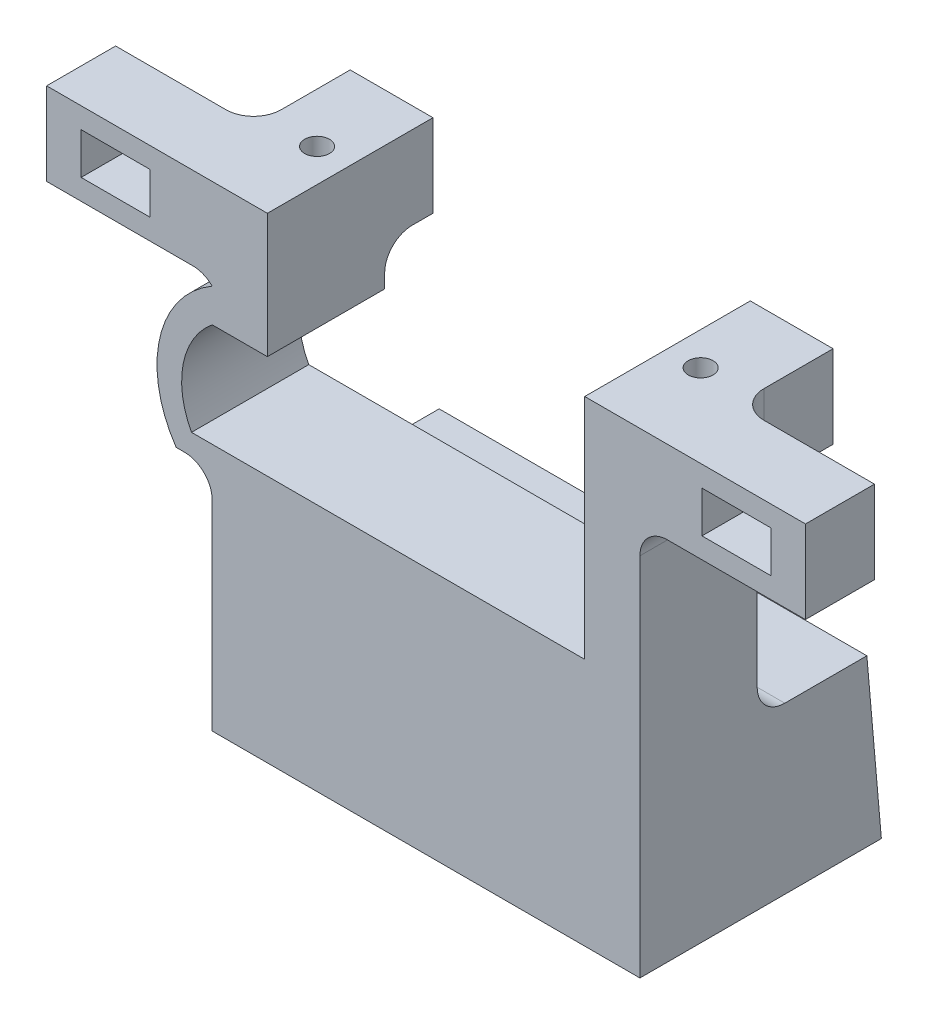
from build123d import *

# Parameters (mm, degrees)
SKETCH1_W                   = 6
SKETCH1_H                   = 12
SKETCH1_R                   = 0.9
SERVO_MOUNTING_BASE_DEPTH   = 6
SERVO_MOUNTING_BASE_2_DEPTH = 6
SERVO_ENCLOSING_FRAME_DEPTH = 2.5
WIRE_SLOT_DEPTH             = 34.977934016
WIRE_SLOT_DEPTH_BACK        = 34.977934016
SKETCH6_W                   = 4
SKETCH6_H                   = 9
WIRE_COMPENSATION_DEPTH     = 2.5
CLAMP_EXTENSION_DEPTH       = 31
SKETCH12_W                  = 1.9
SKETCH12_H                  = 12.5
SKETCH13_R                  = 1.375
CLAMP_SCREW_HOLES_DEPTH     = 6
SKETCH15_W                  = 10
SKETCH15_H                  = 5
ZIPTIE_FLAPS_DEPTH          = 6
ZIPTIE_HOLES_REACH          = 45.298
SKETCH17_W                  = 5
SKETCH17_H                  = 3
FRONT_EXTENSION_DEPTH       = 3.5
F_2MM_FILLETS_R             = 2
MORE_2MM_FILLETS_R          = 2


with BuildPart() as part:
    # Sketch1 → Servo Mounting Base (new body)
    with BuildSketch(Plane(origin=(0, 0, 0), x_dir=(1, 0, 0), z_dir=(0, 1, 0))):
        with Locations((-14.5, 0)):
            Rectangle(SKETCH1_W, SKETCH1_H)
        with Locations(Location((-13.9, 0, 0), (0, 0, 270))):
            Circle(SKETCH1_R, mode=Mode.SUBTRACT)
    extrude(amount=SERVO_MOUNTING_BASE_DEPTH)



with BuildPart() as body_2:
    # Sketch1 → Servo Mounting Base 2 (new body)
    with BuildSketch(Plane(origin=(0, 0, 0), x_dir=(1, 0, 0), z_dir=(0, 1, 0))):
        with Locations((14.5, 0)):
            Rectangle(SKETCH1_W, SKETCH1_H)
        with Locations(Location((13.9, 0, 0), (0, 0, 270))):
            Circle(SKETCH1_R, mode=Mode.SUBTRACT)
    extrude(amount=SERVO_MOUNTING_BASE_2_DEPTH)


with BuildPart() as part_1:
    add(part.part)

    add(body_2.part)  # Servo Enclosing Frame merges body 2
    # Sketch2 → Servo Enclosing Frame (add, symmetric)
    with BuildSketch(Plane.XY):
        Polygon((-15.5, 0), (-15.5, -28.5), (15.5, -28.5), (15.5, 0), (11.5, 0), (11.5, -10.5), (-11.5, -10.5), (-11.5, 0), align=None)
    extrude(amount=SERVO_ENCLOSING_FRAME_DEPTH, both=True)

    # Sketch6 → Wire Slot (cut, two sides: drawn at the far end of the back side and taken through both)
    with BuildSketch(Plane.XY.offset(-WIRE_SLOT_DEPTH_BACK)):
        with Locations((-13.5, -7.5)):
            Rectangle(SKETCH6_W, SKETCH6_H)
    extrude(amount=WIRE_SLOT_DEPTH + WIRE_SLOT_DEPTH_BACK, mode=Mode.SUBTRACT)


with BuildPart() as wire_slot_piece_1:
    # of the separate pieces the step leaves, piece 1, a body of its own (wire_slot_pieces)
    add(part_1.part.solids().sort_by_distance((11.5, -10.5, -2.5))[0])



with BuildPart() as wire_slot_piece_2:
    # of the separate pieces the step leaves, piece 2, a body of its own (wire_slot_pieces)
    add(part_1.part.solids().sort_by_distance((-17.5, 0, -6))[0])


with BuildPart() as wire_slot_piece_1_1:
    add(wire_slot_piece_1.part)

    add(wire_slot_piece_2.part)  # Wire Compensation merges Wire Slot piece 2
    # Sketch7 → Wire Compensation (add, symmetric)
    with BuildSketch(Plane.XY):
        with BuildLine():
            Line((-11.5, -12), (-18.114378278, -12))
            ThreePointArc((-18.114378278, -12), (-19.298539211, -5.715963516), (-15.5, -0.57179677))
            Line((-15.5, -0.57179677), (-15.5, -3))
            ThreePointArc((-15.5, -3), (-17.599955118, -6.480008976), (-17, -10.5))
            Line((-17, -10.5), (-11.5, -10.5))
            Line((-11.5, -10.5), (-11.5, -12))
        make_face()
    extrude(amount=WIRE_COMPENSATION_DEPTH, both=True)

    # Sketch9 → Clamp Extension (add)
    with BuildSketch(Plane.ZY.offset(15.5)):
        Polygon((-2.5, -28.5), (-11.5, -28.5), (-10.450136038, -16.5), (-2.5, -16.5), align=None)
    extrude(amount=-CLAMP_EXTENSION_DEPTH)

    # Sketch12 → Wire Groove (revolve, cut)
    with BuildSketch(Plane(origin=(0, 0.781987502, -8.938158048), x_dir=(-1, 0, 0), z_dir=(0, 0.08715574274766176, -0.9961946980917453))):
        with Locations((-0.95, -23.143839937)):
            Rectangle(SKETCH12_W, SKETCH12_H)
    revolve(axis=Axis((0, -16.047566274, -10.410553216), (0, -0.9961946980917452, -0.0871557427476618)), mode=Mode.SUBTRACT)

    # Sketch13 → Clamp Screw Holes (cut)
    with BuildSketch(Plane(origin=(0, 0.781987502, -8.938158048), x_dir=(-1, 0, 0), z_dir=(0, 0.08715574274766176, -0.9961946980917453))):
        with Locations(Location((-8.5, -23.370920912, 0), (0, 0, 90))):
            Circle(SKETCH13_R)
        with Locations(Location((8.5, -23.370920912, 0), (0, 0, 270))):
            Circle(SKETCH13_R)
    extrude(amount=-CLAMP_SCREW_HOLES_DEPTH, mode=Mode.SUBTRACT)

    # Sketch15 → Ziptie Flaps (add)
    with BuildSketch(Plane(origin=(0, 6, 0), x_dir=(1, 0, 0), z_dir=(0, 1, 0))):
        with Locations((-22.5, -3.5)):
            Rectangle(SKETCH15_W, SKETCH15_H)
        with Locations((22.5, -3.5)):
            Rectangle(SKETCH15_W, SKETCH15_H)
    extrude(amount=-ZIPTIE_FLAPS_DEPTH)

    # Sketch17 → Ziptie Holes (cut, up to next)
    with BuildSketch(Plane.XY.offset(6), mode=Mode.PRIVATE) as ziptie_holes_sk1:
        with Locations((-22.5, 3)):
            Rectangle(SKETCH17_W, SKETCH17_H)
    ziptie_holes_tool1 = extrude(ziptie_holes_sk1.sketch, amount=-ZIPTIE_HOLES_REACH, mode=Mode.PRIVATE) & wire_slot_piece_1_1.part
    # Sketch17 → Ziptie Holes (cut, up to next)
    with BuildSketch(Plane.XY.offset(6), mode=Mode.PRIVATE) as ziptie_holes_sk2:
        with Locations((22.5, 3)):
            Rectangle(SKETCH17_W, SKETCH17_H)
    ziptie_holes_tool2 = extrude(ziptie_holes_sk2.sketch, amount=-ZIPTIE_HOLES_REACH, mode=Mode.PRIVATE) & wire_slot_piece_1_1.part
    add(ziptie_holes_tool1.solids().sort_by_distance((-22.5, 3, 6))[0], mode=Mode.SUBTRACT)
    add(ziptie_holes_tool2.solids().sort_by_distance((22.5, 3, 6))[0], mode=Mode.SUBTRACT)

    # Sketch16 → Front Extension (add)
    with BuildSketch(Plane.XY.offset(2.5)):
        with BuildLine():
            Line((-15.5, 0), (-15.5, -0.57179677))
            ThreePointArc((-15.5, -0.57179677), (-19.298539211, -5.715963516), (-18.114378278, -12))
            Line((-18.114378278, -12), (-15.5, -12))
            Line((-15.5, -12), (-15.5, -28.5))
            Line((-15.5, -28.5), (15.5, -28.5))
            Line((15.5, -28.5), (15.5, 0))
            Line((15.5, 0), (11.5, 0))
            Line((11.5, 0), (11.5, -10.5))
            Line((11.5, -10.5), (-17, -10.5))
            ThreePointArc((-17, -10.5), (-17.599955118, -6.480008976), (-15.5, -3))
            Line((-15.5, -3), (-11.5, -3))
            Line((-11.5, -3), (-11.5, 0))
            Line((-11.5, 0), (-15.5, 0))
        make_face()
    extrude(amount=FRONT_EXTENSION_DEPTH)

    # 2mm Fillets
    # the kernel refuses this fillet: 2 mm, written as the material it adds along each edge
    with BuildSketch(Plane(origin=(15.5, 0, 6), x_dir=(1, 0, 0), z_dir=(0, 0, -1)), Plane(origin=(-15.5, -12, 6), x_dir=(0, -1, 0), z_dir=(0, 0, -1))) as f_2mm_fillets_piece_1:
        with BuildLine():
            CenterArc((F_2MM_FILLETS_R, F_2MM_FILLETS_R), F_2MM_FILLETS_R, 180, 90)
            Line((0, F_2MM_FILLETS_R), (-F_2MM_FILLETS_R * 0.02, F_2MM_FILLETS_R))
            Line((-F_2MM_FILLETS_R * 0.02, F_2MM_FILLETS_R), (-F_2MM_FILLETS_R * 0.02, -F_2MM_FILLETS_R * 0.02))
            Line((-F_2MM_FILLETS_R * 0.02, -F_2MM_FILLETS_R * 0.02), (F_2MM_FILLETS_R, -F_2MM_FILLETS_R * 0.02))
            Line((F_2MM_FILLETS_R, -F_2MM_FILLETS_R * 0.02), (F_2MM_FILLETS_R, 0))
        make_face()
    extrude(amount=8.5)
    with BuildSketch(Plane(origin=(15.5, 0, -2.5), x_dir=(0, -1, 0), z_dir=(-1, 0, 0))) as f_2mm_fillets_piece_2:
        with BuildLine():
            CenterArc((F_2MM_FILLETS_R, -F_2MM_FILLETS_R), F_2MM_FILLETS_R, 90, 90)
            Line((0, -F_2MM_FILLETS_R), (-F_2MM_FILLETS_R * 0.02, -F_2MM_FILLETS_R))
            Line((-F_2MM_FILLETS_R * 0.02, -F_2MM_FILLETS_R), (-F_2MM_FILLETS_R * 0.02, F_2MM_FILLETS_R * 0.02))
            Line((-F_2MM_FILLETS_R * 0.02, F_2MM_FILLETS_R * 0.02), (F_2MM_FILLETS_R, F_2MM_FILLETS_R * 0.02))
            Line((F_2MM_FILLETS_R, F_2MM_FILLETS_R * 0.02), (F_2MM_FILLETS_R, 0))
        make_face()
    extrude(amount=4)
    with BuildSketch(Plane(origin=(-15.5, -16.5, -2.5), x_dir=(0, 1, 0), z_dir=(1, 0, 0))) as f_2mm_fillets_piece_3:
        with BuildLine():
            CenterArc((F_2MM_FILLETS_R, -F_2MM_FILLETS_R), F_2MM_FILLETS_R, 90, 90)
            Line((0, -F_2MM_FILLETS_R), (-F_2MM_FILLETS_R * 0.02, -F_2MM_FILLETS_R))
            Line((-F_2MM_FILLETS_R * 0.02, -F_2MM_FILLETS_R), (-F_2MM_FILLETS_R * 0.02, F_2MM_FILLETS_R * 0.02))
            Line((-F_2MM_FILLETS_R * 0.02, F_2MM_FILLETS_R * 0.02), (F_2MM_FILLETS_R, F_2MM_FILLETS_R * 0.02))
            Line((F_2MM_FILLETS_R, F_2MM_FILLETS_R * 0.02), (F_2MM_FILLETS_R, 0))
        make_face()
    extrude(amount=31)
    with BuildSketch(Plane(origin=(-17.5, 6, 1), x_dir=(-1, 0, 0), z_dir=(0, -1, 0))) as f_2mm_fillets_piece_4:
        with BuildLine():
            CenterArc((F_2MM_FILLETS_R, F_2MM_FILLETS_R), F_2MM_FILLETS_R, 180, 90)
            Line((0, F_2MM_FILLETS_R), (-F_2MM_FILLETS_R * 0.02, F_2MM_FILLETS_R))
            Line((-F_2MM_FILLETS_R * 0.02, F_2MM_FILLETS_R), (-F_2MM_FILLETS_R * 0.02, -F_2MM_FILLETS_R * 0.02))
            Line((-F_2MM_FILLETS_R * 0.02, -F_2MM_FILLETS_R * 0.02), (F_2MM_FILLETS_R, -F_2MM_FILLETS_R * 0.02))
            Line((F_2MM_FILLETS_R, -F_2MM_FILLETS_R * 0.02), (F_2MM_FILLETS_R, 0))
        make_face()
    extrude(amount=6)
    with BuildSketch(Plane(origin=(-11.5, 0, -2.5), x_dir=(0, -1, 0), z_dir=(-1, 0, 0))) as f_2mm_fillets_piece_5_section:
        with BuildLine():
            CenterArc((F_2MM_FILLETS_R, -F_2MM_FILLETS_R), F_2MM_FILLETS_R, 90, 90)
            Line((0, -F_2MM_FILLETS_R), (-F_2MM_FILLETS_R * 0.02, -F_2MM_FILLETS_R))
            Line((-F_2MM_FILLETS_R * 0.02, -F_2MM_FILLETS_R), (-F_2MM_FILLETS_R * 0.02, F_2MM_FILLETS_R * 0.02))
            Line((-F_2MM_FILLETS_R * 0.02, F_2MM_FILLETS_R * 0.02), (F_2MM_FILLETS_R, F_2MM_FILLETS_R * 0.02))
            Line((F_2MM_FILLETS_R, F_2MM_FILLETS_R * 0.02), (F_2MM_FILLETS_R, 0))
        make_face()
    f_2mm_fillets_piece_5 = extrude(amount=4, mode=Mode.PRIVATE)
    f_2mm_fillets_piece_5 = f_2mm_fillets_piece_5 & Plane(origin=(-11.5, -7.5, -2.916455702), x_dir=(-0.8267972847076845, -0.5625, 0), z_dir=(0, 0, 1)) * Cylinder(8, 16, mode=Mode.PRIVATE)
    add(f_2mm_fillets_piece_5)
    with BuildSketch(Plane(origin=(-11.5, 0, -2.5), x_dir=(0, -1, 0), z_dir=(-1, 0, 0))) as f_2mm_fillets_piece_6_section:
        with BuildLine():
            CenterArc((F_2MM_FILLETS_R, -F_2MM_FILLETS_R), F_2MM_FILLETS_R, 90, 90)
            Line((0, -F_2MM_FILLETS_R), (-F_2MM_FILLETS_R * 0.02, -F_2MM_FILLETS_R))
            Line((-F_2MM_FILLETS_R * 0.02, -F_2MM_FILLETS_R), (-F_2MM_FILLETS_R * 0.02, F_2MM_FILLETS_R * 0.02))
            Line((-F_2MM_FILLETS_R * 0.02, F_2MM_FILLETS_R * 0.02), (F_2MM_FILLETS_R, F_2MM_FILLETS_R * 0.02))
            Line((F_2MM_FILLETS_R, F_2MM_FILLETS_R * 0.02), (F_2MM_FILLETS_R, 0))
        make_face()
    f_2mm_fillets_piece_6 = extrude(amount=4, mode=Mode.PRIVATE)
    f_2mm_fillets_piece_6 = f_2mm_fillets_piece_6 - Plane(origin=(-11.5, -7.5, -3.204669356), x_dir=(-0.8267972847076845, -0.5625, 0), z_dir=(0, 0, 1)) * Cylinder(8, 16, mode=Mode.PRIVATE)
    add(f_2mm_fillets_piece_6)
    with BuildSketch(Plane(origin=(-11.5, 0, -2.5), x_dir=(0, -1, 0), z_dir=(-1, 0, 0))) as f_2mm_fillets_piece_7_section:
        with BuildLine():
            CenterArc((F_2MM_FILLETS_R, -F_2MM_FILLETS_R), F_2MM_FILLETS_R, 90, 90)
            Line((0, -F_2MM_FILLETS_R), (-F_2MM_FILLETS_R * 0.02, -F_2MM_FILLETS_R))
            Line((-F_2MM_FILLETS_R * 0.02, -F_2MM_FILLETS_R), (-F_2MM_FILLETS_R * 0.02, F_2MM_FILLETS_R * 0.02))
            Line((-F_2MM_FILLETS_R * 0.02, F_2MM_FILLETS_R * 0.02), (F_2MM_FILLETS_R, F_2MM_FILLETS_R * 0.02))
            Line((F_2MM_FILLETS_R, F_2MM_FILLETS_R * 0.02), (F_2MM_FILLETS_R, 0))
        make_face()
    f_2mm_fillets_piece_7 = extrude(amount=9, mode=Mode.PRIVATE)
    f_2mm_fillets_piece_7 = f_2mm_fillets_piece_7 & Plane(origin=(-11.5, -7.5, -2.577343051), x_dir=(-0.8267972847076845, -0.5625, 0), z_dir=(0, 0, 1)) * Cylinder(8, 26, mode=Mode.PRIVATE)
    f_2mm_fillets_piece_7 = split(f_2mm_fillets_piece_7, bisect_by=Plane(origin=(-15.5, -1.226769703, -2.577343051), z_dir=(-1, 0, 0)), keep=Keep.TOP, mode=Mode.PRIVATE)
    add(f_2mm_fillets_piece_7)
    with BuildSketch(Plane(origin=(-15.5, 0, -2.5), x_dir=(0, -1, 0), z_dir=(0, 0, 1))) as f_2mm_fillets_piece_8:
        with BuildLine():
            CenterArc((2, -1.400084116), F_2MM_FILLETS_R, 135.569621566, 44.430378434)
            Line((0, -1.400084116), (-0.04, -1.400084116))
            Line((-0.04, -1.400084116), (-0.04, 0))
            Line((-0.04, 0), (0, 0.04))
            ThreePointArc((0, 0.04), (0.285898385, 0.04), (0.543232705, 0.028001682))
            Line((0.543232705, 0.028001682), (0.57179677, 0))
        make_face()
    extrude(amount=8.5)
    with BuildSketch(Plane(origin=(20.5, 0, -2.5), x_dir=(0, -1, 0), z_dir=(-1, 0, 0))) as f_2mm_fillets_piece_9a_section:
        with BuildLine():
            CenterArc((F_2MM_FILLETS_R, -F_2MM_FILLETS_R), F_2MM_FILLETS_R, 90, 90)
            Line((0, -F_2MM_FILLETS_R), (-F_2MM_FILLETS_R * 0.02, -F_2MM_FILLETS_R))
            Line((-F_2MM_FILLETS_R * 0.02, -F_2MM_FILLETS_R), (-F_2MM_FILLETS_R * 0.02, F_2MM_FILLETS_R * 0.02))
            Line((-F_2MM_FILLETS_R * 0.02, F_2MM_FILLETS_R * 0.02), (F_2MM_FILLETS_R, F_2MM_FILLETS_R * 0.02))
            Line((F_2MM_FILLETS_R, F_2MM_FILLETS_R * 0.02), (F_2MM_FILLETS_R, 0))
        make_face()
    f_2mm_fillets_piece_9a = extrude(amount=9, mode=Mode.PRIVATE)
    f_2mm_fillets_piece_9a = split(f_2mm_fillets_piece_9a, bisect_by=Plane(origin=(17.5, -0.452790229, -2.952790229), z_dir=(-1, 0, 0)), keep=Keep.TOP, mode=Mode.PRIVATE)
    f_2mm_fillets_piece_9a = split(f_2mm_fillets_piece_9a, bisect_by=Plane(origin=(15.5, -0.452790229, -2.952790229), z_dir=(1, 0, 0)), keep=Keep.TOP, mode=Mode.PRIVATE)
    with BuildSketch(Plane(origin=(15.5, 0, 6), x_dir=(1, 0, 0), z_dir=(0, 0, -1))) as f_2mm_fillets_piece_9b_section:
        with BuildLine():
            CenterArc((F_2MM_FILLETS_R, F_2MM_FILLETS_R), F_2MM_FILLETS_R, 180, 90)
            Line((0, F_2MM_FILLETS_R), (-F_2MM_FILLETS_R * 0.02, F_2MM_FILLETS_R))
            Line((-F_2MM_FILLETS_R * 0.02, F_2MM_FILLETS_R), (-F_2MM_FILLETS_R * 0.02, -F_2MM_FILLETS_R * 0.02))
            Line((-F_2MM_FILLETS_R * 0.02, -F_2MM_FILLETS_R * 0.02), (F_2MM_FILLETS_R, -F_2MM_FILLETS_R * 0.02))
            Line((F_2MM_FILLETS_R, -F_2MM_FILLETS_R * 0.02), (F_2MM_FILLETS_R, 0))
        make_face()
    f_2mm_fillets_piece_9b = extrude(amount=13.5, mode=Mode.PRIVATE)
    f_2mm_fillets_piece_9b = split(f_2mm_fillets_piece_9b, bisect_by=Plane(origin=(15.952790229, -0.452790229, -6), z_dir=(0, 0, 1)), keep=Keep.TOP, mode=Mode.PRIVATE)
    f_2mm_fillets_piece_9b = split(f_2mm_fillets_piece_9b, bisect_by=Plane(origin=(15.952790229, -0.452790229, -2.5), z_dir=(0, 0, -1)), keep=Keep.TOP, mode=Mode.PRIVATE)
    f_2mm_fillets_piece_9 = f_2mm_fillets_piece_9a & f_2mm_fillets_piece_9b
    add(f_2mm_fillets_piece_9)
    with BuildSketch(Plane(origin=(-11.5, 0, -2.5), x_dir=(0, -1, 0), z_dir=(-1, 0, 0))) as f_2mm_fillets_piece_10a_section:
        with BuildLine():
            CenterArc((F_2MM_FILLETS_R, -F_2MM_FILLETS_R), F_2MM_FILLETS_R, 90, 90)
            Line((0, -F_2MM_FILLETS_R), (-F_2MM_FILLETS_R * 0.02, -F_2MM_FILLETS_R))
            Line((-F_2MM_FILLETS_R * 0.02, -F_2MM_FILLETS_R), (-F_2MM_FILLETS_R * 0.02, F_2MM_FILLETS_R * 0.02))
            Line((-F_2MM_FILLETS_R * 0.02, F_2MM_FILLETS_R * 0.02), (F_2MM_FILLETS_R, F_2MM_FILLETS_R * 0.02))
            Line((F_2MM_FILLETS_R, F_2MM_FILLETS_R * 0.02), (F_2MM_FILLETS_R, 0))
        make_face()
    f_2mm_fillets_piece_10a = extrude(amount=9, mode=Mode.PRIVATE)
    f_2mm_fillets_piece_10a = f_2mm_fillets_piece_10a - Plane(origin=(-11.5, -7.5, -2.992619428), x_dir=(-0.8267972847076845, -0.5625, 0), z_dir=(0, 0, 1)) * Cylinder(8, 26, mode=Mode.PRIVATE)
    f_2mm_fillets_piece_10a = split(f_2mm_fillets_piece_10a, bisect_by=Plane(origin=(-15.5, -0.370682852, -2.992619428), z_dir=(-1, 0, 0)), keep=Keep.TOP, mode=Mode.PRIVATE)
    f_2mm_fillets_piece_10a = split(f_2mm_fillets_piece_10a, bisect_by=Plane(origin=(-17.5, -0.370682852, -2.992619428), z_dir=(1, 0, 0)), keep=Keep.TOP, mode=Mode.PRIVATE)
    with BuildSketch(Plane(origin=(-15.5, 0, -6.000210291), x_dir=(0, -1, 0), z_dir=(0, 0, 1))) as f_2mm_fillets_piece_10b_section:
        with BuildLine():
            CenterArc((2, -1.400084116), F_2MM_FILLETS_R, 135.569621566, 44.430378434)
            Line((0, -1.400084116), (-0.04, -1.400084116))
            Line((-0.04, -1.400084116), (-0.04, 0))
            Line((-0.04, 0), (0, 0.04))
            ThreePointArc((0, 0.04), (0.285898385, 0.04), (0.543232705, 0.028001682))
            Line((0.543232705, 0.028001682), (0.57179677, 0))
        make_face()
    f_2mm_fillets_piece_10b = extrude(amount=12.000210291, mode=Mode.PRIVATE)
    f_2mm_fillets_piece_10b = split(f_2mm_fillets_piece_10b, bisect_by=Plane(origin=(-15.876915422, -0.140265122, -6), z_dir=(0, 0, 1)), keep=Keep.TOP, mode=Mode.PRIVATE)
    f_2mm_fillets_piece_10b = split(f_2mm_fillets_piece_10b, bisect_by=Plane(origin=(-15.876915422, -0.140265122, -2.5), z_dir=(0, 0, -1)), keep=Keep.TOP, mode=Mode.PRIVATE)
    f_2mm_fillets_piece_10 = f_2mm_fillets_piece_10a & f_2mm_fillets_piece_10b
    add(f_2mm_fillets_piece_10)

    # More 2mm Fillets
    more_2mm_fillets_edges = [wire_slot_piece_1_1.edges().sort_by_distance(p)[0] for p in [
        (17.5, 3, 1),
    ]]
    fillet(more_2mm_fillets_edges, radius=MORE_2MM_FILLETS_R)


solid = wire_slot_piece_1_1.part
